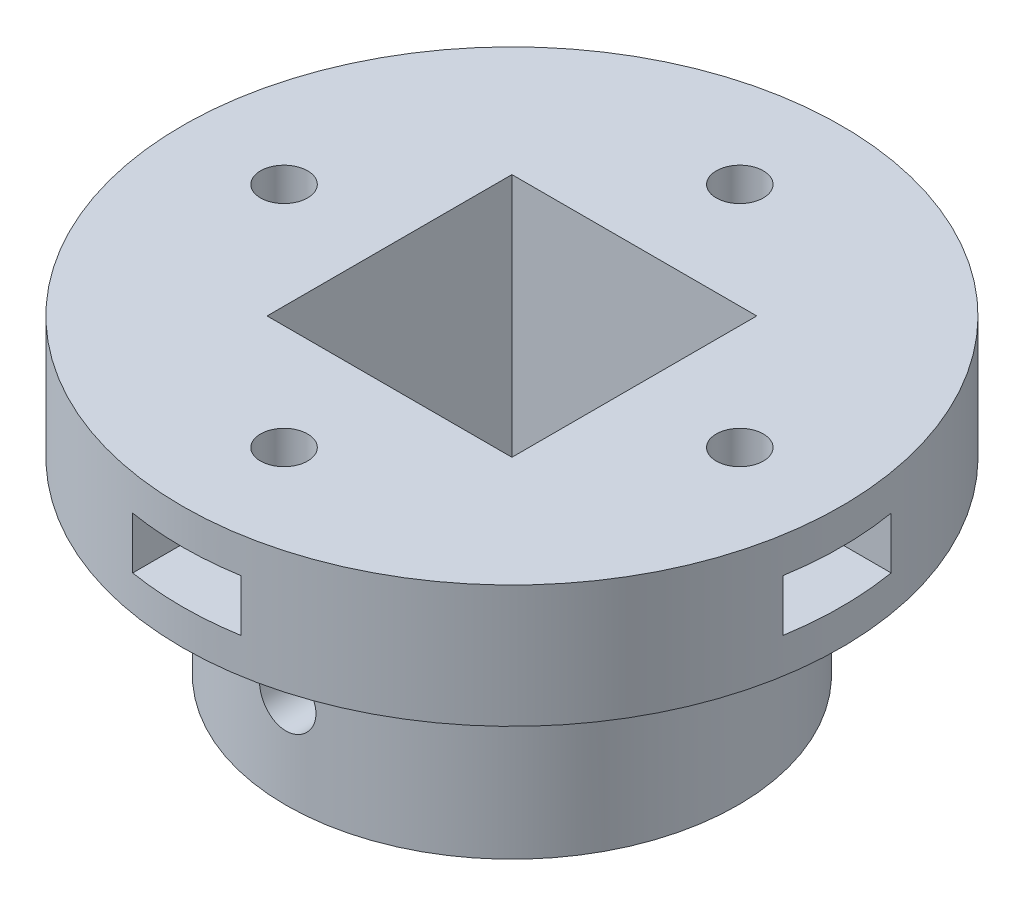
from build123d import *

# Parameters (mm, degrees)
SKETCH1_R                      = 12
SKETCH1_W                      = 13
SKETCH1_H                      = 13
BOSS_EXTRUDE1_DEPTH            = 10
SKETCH2_R                      = 17.5
BOSS_EXTRUDE2_DEPTH            = 6.5
CUT_EXTRUDE1_REACH             = 28.693
SKETCH3_R                      = 1.25
CUT_EXTRUDE2_DEPTH             = 30.744747435
CUT_EXTRUDE2_DEPTH_BACK        = 30.744747435
SKETCH4_R                      = 1.5
CUT_EXTRUDE3_REACH             = 28.693
SKETCH6_W                      = 13
SKETCH6_H                      = 13
CUT_EXTRUDE3_DIRECTION_2_DEPTH = 10
SKETCH8_W                      = 5.75
SKETCH8_H                      = 2.75
CUT_EXTRUDE4_DEPTH             = 5
CUT_EXTRUDE5_DEPTH             = 2.75
CIRPATTERN1_START              = 11.875
CIRPATTERN1_OUTLINE_R          = 1.25
CIRPATTERN1_DEPTH              = 2.75


# Read off the part's stored shape, not the designer's step: CirPattern1
with BuildPart() as part:
    # Sketch1 → Boss-Extrude1 (new body)
    with BuildSketch(Plane(origin=(0, 0, 0), x_dir=(1, 0, 0), z_dir=(0, 1, 0))):
        with Locations(Location((0, 0, 0), (0, 0, 270))):
            Circle(SKETCH1_R)
        Rectangle(SKETCH1_W, SKETCH1_H, mode=Mode.SUBTRACT)
    extrude(amount=BOSS_EXTRUDE1_DEPTH)

    # Sketch2 → Boss-Extrude2 (add)
    with BuildSketch(Plane(origin=(0, 10, 0), x_dir=(1, 0, 0), z_dir=(0, 1, 0))):
        with Locations(Location((0, 0, 0), (0, 0, 90))):
            Circle(SKETCH2_R)
    extrude(amount=BOSS_EXTRUDE2_DEPTH)

    # Sketch3 → Cut-Extrude1 (cut, up to next)
    with BuildSketch(Plane.XZ.offset(-10), mode=Mode.PRIVATE) as cut_extrude1_sk1:
        with Locations(Location((12.1, 0, 0), (0, 0, 262.453989537))):
            Circle(SKETCH3_R)
    cut_extrude1_tool1 = extrude(cut_extrude1_sk1.sketch, amount=-CUT_EXTRUDE1_REACH, mode=Mode.PRIVATE) & part.part
    # Sketch3 → Cut-Extrude1 (cut, up to next)
    with BuildSketch(Plane.XZ.offset(-10), mode=Mode.PRIVATE) as cut_extrude1_sk2:
        with Locations(Location((0, -12.1, 0), (0, 0, 172.453989537))):
            Circle(SKETCH3_R)
    cut_extrude1_tool2 = extrude(cut_extrude1_sk2.sketch, amount=-CUT_EXTRUDE1_REACH, mode=Mode.PRIVATE) & part.part
    # Sketch3 → Cut-Extrude1 (cut, up to next)
    with BuildSketch(Plane.XZ.offset(-10), mode=Mode.PRIVATE) as cut_extrude1_sk3:
        with Locations(Location((-12.1, 0, 0), (0, 0, 277.546010463))):
            Circle(SKETCH3_R)
    cut_extrude1_tool3 = extrude(cut_extrude1_sk3.sketch, amount=-CUT_EXTRUDE1_REACH, mode=Mode.PRIVATE) & part.part
    # Sketch3 → Cut-Extrude1 (cut, up to next)
    with BuildSketch(Plane.XZ.offset(-10), mode=Mode.PRIVATE) as cut_extrude1_sk4:
        with Locations(Location((0, 12.1, 0), (0, 0, 187.546010463))):
            Circle(SKETCH3_R)
    cut_extrude1_tool4 = extrude(cut_extrude1_sk4.sketch, amount=-CUT_EXTRUDE1_REACH, mode=Mode.PRIVATE) & part.part
    add(cut_extrude1_tool1.solids().sort_by_distance((12.1, 10, 0))[0], mode=Mode.SUBTRACT)
    add(cut_extrude1_tool2.solids().sort_by_distance((0, 10, -12.1))[0], mode=Mode.SUBTRACT)
    add(cut_extrude1_tool3.solids().sort_by_distance((-12.1, 10, 0))[0], mode=Mode.SUBTRACT)
    add(cut_extrude1_tool4.solids().sort_by_distance((0, 10, 12.1))[0], mode=Mode.SUBTRACT)

    # Sketch4 → Cut-Extrude2 (cut, two sides: drawn at the far end of the back side and taken through both)
    with BuildSketch(Plane.XY.offset(-CUT_EXTRUDE2_DEPTH_BACK)):
        with Locations((0, 4.916404418)):
            Circle(SKETCH4_R)
    extrude(amount=CUT_EXTRUDE2_DEPTH + CUT_EXTRUDE2_DEPTH_BACK, mode=Mode.SUBTRACT)

    # Sketch6 → Cut-Extrude3 (cut, up to next)
    with BuildSketch(Plane(origin=(0, 10, 0), x_dir=(-1, 0, 0), z_dir=(0, -1, 0)), mode=Mode.PRIVATE) as cut_extrude3_sk1:
        Rectangle(SKETCH6_W, SKETCH6_H)
    cut_extrude3_tool1 = extrude(cut_extrude3_sk1.sketch, amount=-CUT_EXTRUDE3_REACH, mode=Mode.PRIVATE) & part.part
    add(cut_extrude3_tool1.solids().sort_by_distance((0, 10, 0))[0], mode=Mode.SUBTRACT)

    # Sketch6 → Cut-Extrude3 direction 2 (cut)
    with BuildSketch(Plane(origin=(0, 10, 0), x_dir=(-1, 0, 0), z_dir=(0, -1, 0))):
        Rectangle(SKETCH6_W, SKETCH6_H)
    extrude(amount=CUT_EXTRUDE3_DIRECTION_2_DEPTH, mode=Mode.SUBTRACT)

    # Sketch8 → Cut-Extrude4 (cut)
    with BuildSketch(Plane(origin=(17.5, 0, 0), x_dir=(0, 0, -1), z_dir=(1, 0, 0))):
        with Locations((0, 13.25)):
            Rectangle(SKETCH8_W, SKETCH8_H)
    extrude(amount=-CUT_EXTRUDE4_DEPTH, mode=Mode.SUBTRACT)

    # Sketch9 → Cut-Extrude5 (cut)
    with BuildSketch(Plane.XZ.offset(-14.625)):
        Polygon((15.419764048, 0), (13.759882024, 2.875), (10.440117976, 2.875), (8.780235952, 0), (10.440117976, -2.875), (13.759882024, -2.875), align=None)
    extrude(amount=CUT_EXTRUDE5_DEPTH, mode=Mode.SUBTRACT)

    # CirPattern1 outline → CirPattern1 (cut)
    # profile 1 of 3: a face of its own
    with BuildSketch(Plane(origin=(0, 0, 0), x_dir=(1, 0, 0), z_dir=(0, 1, 0)).offset(CIRPATTERN1_START)):
        with BuildLine():
            Line((-8.780235952, 0), (-10.440117976, 2.875))
            Line((-10.440117976, 2.875), (-17.26222393, 2.875))
            ThreePointArc((-17.26222393, 2.875), (-17.5, 0), (-17.26222393, -2.875))
            Line((-17.26222393, -2.875), (-10.440117976, -2.875))
            Line((-10.440117976, -2.875), (-8.780235952, 0))
        make_face()
        with Locations((-12.1, 0)):
            Circle(CIRPATTERN1_OUTLINE_R, mode=Mode.SUBTRACT)
    # profile 2 of 3: a face of its own
    with BuildSketch(Plane(origin=(0, 0, 0), x_dir=(1, 0, 0), z_dir=(0, 1, 0)).offset(CIRPATTERN1_START)):
        with BuildLine():
            ThreePointArc((2.875, 17.26222393), (0, 17.5), (-2.875, 17.26222393))
            Line((-2.875, 17.26222393), (-2.875, 10.440117976))
            Line((-2.875, 10.440117976), (0, 8.780235952))
            Line((0, 8.780235952), (2.875, 10.440117976))
            Line((2.875, 10.440117976), (2.875, 17.26222393))
        make_face()
        with Locations((0, 12.1)):
            Circle(CIRPATTERN1_OUTLINE_R, mode=Mode.SUBTRACT)
    # profile 3 of 3: a face of its own
    with BuildSketch(Plane(origin=(0, 0, 0), x_dir=(1, 0, 0), z_dir=(0, 1, 0)).offset(CIRPATTERN1_START)):
        with BuildLine():
            Line((-2.875, -10.440117976), (-2.875, -17.26222393))
            ThreePointArc((-2.875, -17.26222393), (0, -17.5), (2.875, -17.26222393))
            Line((2.875, -17.26222393), (2.875, -10.440117976))
            Line((2.875, -10.440117976), (0, -8.780235952))
            Line((0, -8.780235952), (-2.875, -10.440117976))
        make_face()
        with Locations((0, -12.1)):
            Circle(CIRPATTERN1_OUTLINE_R, mode=Mode.SUBTRACT)
    extrude(amount=CIRPATTERN1_DEPTH, mode=Mode.SUBTRACT)


solid = part.part
